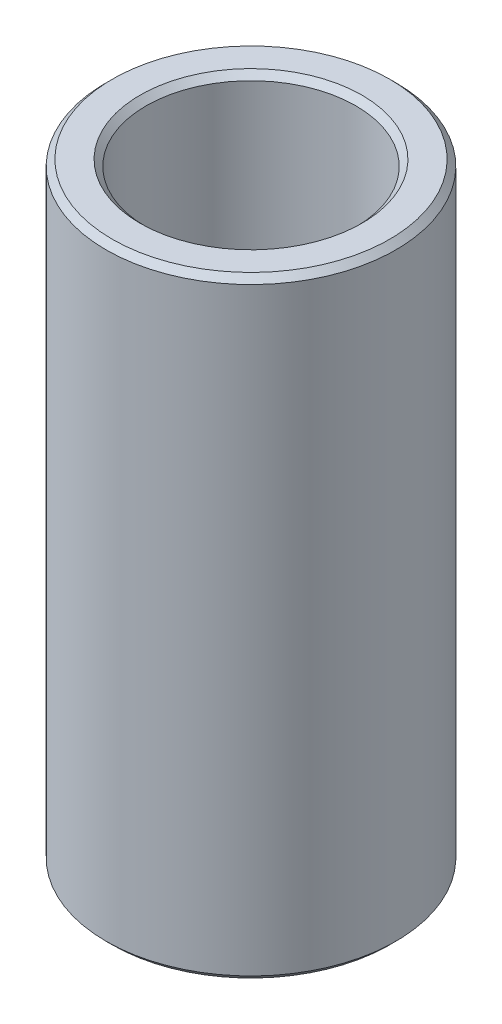
from build123d import *

# Parameters (mm, degrees)
SKETCH1_R           = 42.5
BOSS_EXTRUDE1_DEPTH = 179.309735717
SKETCH2_R           = 30.763778935
CUT_EXTRUDE1_DEPTH  = 190.114994971
CHAMFER1_SIZE       = 1.805336856


with BuildPart() as part:
    # Sketch1 → Boss-Extrude1 (new body)
    with BuildSketch(Plane(origin=(0, 0, 0), x_dir=(1, 0, 0), z_dir=(0, 1, 0))):
        Circle(SKETCH1_R)
    extrude(amount=BOSS_EXTRUDE1_DEPTH)

    # Sketch2 → Cut-Extrude1 (cut, through all)
    with BuildSketch(Plane(origin=(0, 0, 0), x_dir=(1, 0, 0), z_dir=(0, 1, 0))):
        Circle(SKETCH2_R)
    extrude(amount=CUT_EXTRUDE1_DEPTH, mode=Mode.SUBTRACT)

    # Chamfer1
    chamfer1_edges = [part.edges().sort_by_distance(p)[0] for p in [
        (-30.763778935, 179.309735717, 0),
        (-30.763778935, 0, 0),
        (-42.5, 0, 0),
        (-42.5, 179.309735717, 0),
    ]]
    chamfer(chamfer1_edges, length=CHAMFER1_SIZE)


solid = part.part
